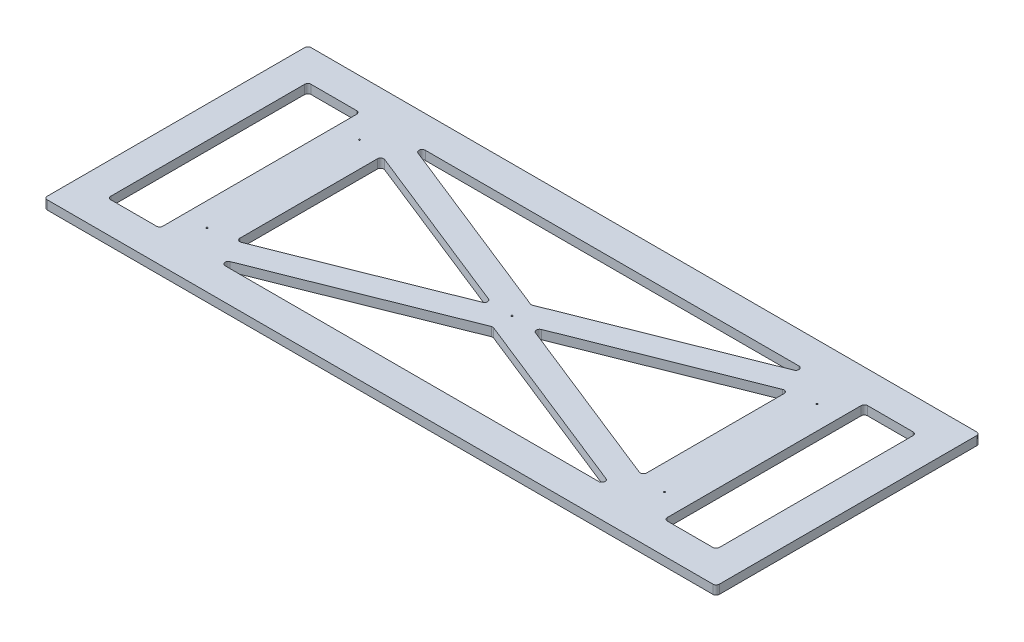
from build123d import *

# Parameters (mm, degrees)
SKETCH1_W                    = 1343.025
SKETCH1_H                    = 527.05
BOSS_EXTRUDE1_DEPTH          = 17.78
FILLET1_R                    = 6.35
F_1_8_0_125_DIAMETER_HOLE1_D = 3.175
SKETCH5_W                    = 103.867264199
SKETCH5_H                    = 400.05
CUT_EXTRUDE1_DEPTH           = 722.588935393
FILLET2_R                    = 6.35


with BuildPart() as part:
    # Sketch1 → Boss-Extrude1 (new body)
    with BuildSketch(Plane(origin=(0, 0, 0), x_dir=(1, 0, 0), z_dir=(0, 1, 0))):
        Rectangle(SKETCH1_W, SKETCH1_H)
    extrude(amount=BOSS_EXTRUDE1_DEPTH)

    # Fillet1
    fillet1_edges = [part.edges().sort_by_distance(p)[0] for p in [
        (-671.5125, 8.89, 263.525),
        (-671.5125, 8.89, -263.525),
        (671.5125, 8.89, -263.525),
        (671.5125, 8.89, 263.525),
    ]]
    fillet(fillet1_edges, radius=FILLET1_R)

    # 1/8 (0.125) Diameter Hole1 (through all)
    with Locations(Plane(origin=(0, 17.78, 0), x_dir=(1, 0, 0), z_dir=(0, 1, 0))):
        with Locations((0, 0), (457.2, 152.4), (-457.2, -152.4), (-457.2, 152.4), (457.2, -152.4)):
            Hole(F_1_8_0_125_DIAMETER_HOLE1_D / 2)

    # Sketch5 → Cut-Extrude1 (cut, through all)
    with BuildSketch(Plane(origin=(0, 17.78, 0), x_dir=(1, 0, 0), z_dir=(0, 1, 0))):
        Polygon((-406.4, 200.025), (406.4, 200.025), (0, 38.1), align=None)
        Polygon((0, -38.1), (-406.4, -200.025), (406.4, -200.025), align=None)
        Polygon((406.4, 146.74453125), (406.4, -146.74453125), (38.1, 0), align=None)
        Polygon((-406.4, 146.74453125), (-38.1, 0), (-406.4, -146.74453125), align=None)
        with Locations((556.0788679, 0)):
            Rectangle(SKETCH5_W, SKETCH5_H)
        with Locations((-556.0788679, 0)):
            Rectangle(SKETCH5_W, SKETCH5_H)
    extrude(amount=-CUT_EXTRUDE1_DEPTH, mode=Mode.SUBTRACT)

    # Fillet2
    fillet2_edges = [part.edges().sort_by_distance(p)[0] for p in [
        (504.145235801, 8.89, -200.025),
        (504.145235801, 8.89, 200.025),
        (608.0125, 8.89, 200.025),
        (406.4, 8.89, 146.74453125),
        (406.4, 8.89, 200.025),
        (608.0125, 8.89, -200.025),
        (406.4, 8.89, -146.74453125),
        (406.4, 8.89, -200.025),
        (38.1, 8.89, 0),
        (0, 8.89, 38.1),
        (0, 8.89, -38.1),
        (-38.1, 8.89, 0),
        (-406.4, 8.89, 200.025),
        (-406.4, 8.89, -200.025),
        (-406.4, 8.89, -146.74453125),
        (-406.4, 8.89, 146.74453125),
        (-608.0125, 8.89, 200.025),
        (-504.145235801, 8.89, 200.025),
        (-504.145235801, 8.89, -200.025),
        (-608.0125, 8.89, -200.025),
    ]]
    fillet(fillet2_edges, radius=FILLET2_R)


solid = part.part
